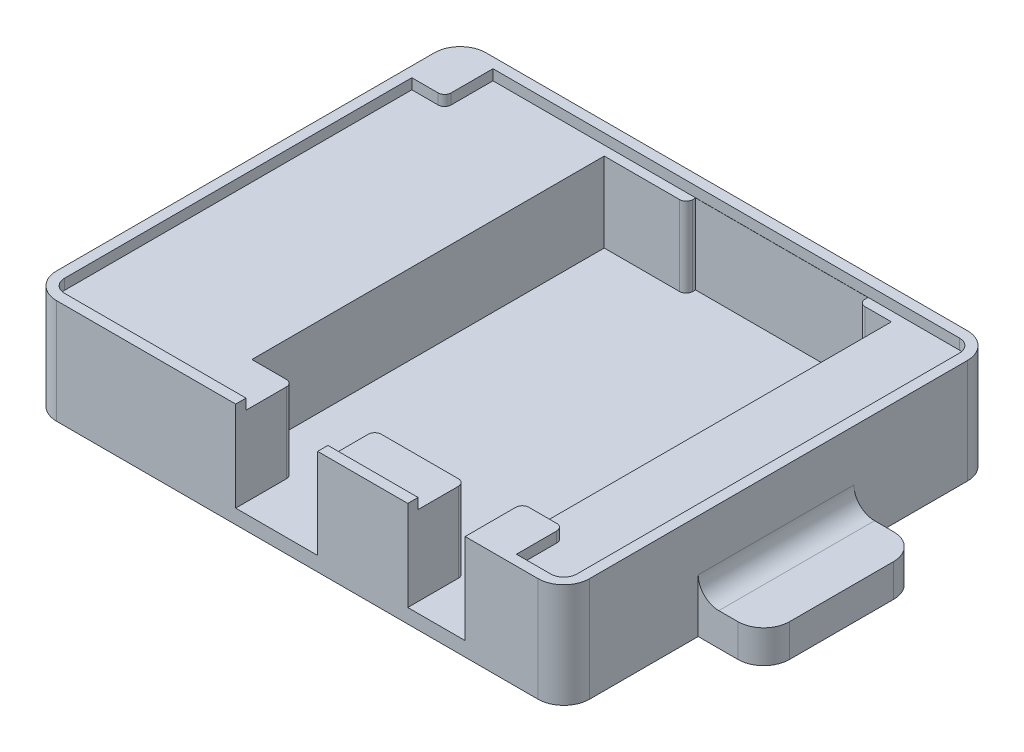
from build123d import *

# Parameters (mm, degrees)
SKETCH1_W           = 103.251
SKETCH1_H           = 83.185
BOSS_EXTRUDE1_DEPTH = 20.2438
CUT_EXTRUDE1_DEPTH  = 17.4625
SKETCH3_W           = 15.875
SKETCH3_H           = 17.4625
SKETCH3_W_2         = 11.1125
CUT_EXTRUDE2_DEPTH  = 14.9225
CUT_EXTRUDE3_DEPTH  = 2.032
SKETCH5_W           = 30.1625
SKETCH5_H           = 6.35
BOSS_EXTRUDE2_DEPTH = 12.7
SKETCH6_W           = 30.1625
SKETCH6_H           = 6.35
BOSS_EXTRUDE3_DEPTH = 12.7
FILLET1_R           = 5
FILLET2_R           = 1.27
FILLET3_R           = 2.54
FILLET4_R           = 4


with BuildPart() as part:
    # Sketch1 → Boss-Extrude1 (new body)
    with BuildSketch(Plane(origin=(0, 0, 0), x_dir=(1, 0, 0), z_dir=(0, 1, 0))):
        with Locations((51.6255, 41.5925)):
            Rectangle(SKETCH1_W, SKETCH1_H)
    extrude(amount=BOSS_EXTRUDE1_DEPTH)

    # Sketch2 → Cut-Extrude1 (cut)
    with BuildSketch(Plane(origin=(0, 20.2438, 0), x_dir=(1, 0, 0), z_dir=(0, 1, 0))):
        Polygon((31.75, 79.3369), (47.625, 79.3369), (47.625, 81.153), (81.026, 81.153), (81.026, 79.3369), (87.376, 79.3369), (87.376, 11.0744), (31.75, 11.0744), align=None)
    extrude(amount=-CUT_EXTRUDE1_DEPTH, mode=Mode.SUBTRACT)

    # Sketch3 → Cut-Extrude2 (cut)
    with BuildSketch(Plane.XY):
        with Locations((47.625, 11.51255)):
            Rectangle(SKETCH3_W, SKETCH3_H)
        with Locations((78.58125, 11.51255)):
            Rectangle(SKETCH3_W_2, SKETCH3_H)
    extrude(amount=-CUT_EXTRUDE2_DEPTH, mode=Mode.SUBTRACT)

    # Sketch4 → Cut-Extrude3 (cut)
    with BuildSketch(Plane(origin=(0, 20.2438, 0), x_dir=(1, 0, 0), z_dir=(0, 1, 0))):
        Polygon((8.35, 81.185), (101.251, 81.185), (101.251, 2), (92.075, 2), (92.075, 11.0744), (84.1375, 11.0744), (84.1375, 2), (2, 2), (2, 71.8124), (8.35, 71.8124), align=None)
    extrude(amount=-CUT_EXTRUDE3_DEPTH, mode=Mode.SUBTRACT)

    # Sketch5 → Boss-Extrude2 (add)
    with BuildSketch(Plane.ZY):
        with Locations((-41.11625, 3.175)):
            Rectangle(SKETCH5_W, SKETCH5_H)
    boss_extrude2 = extrude(amount=BOSS_EXTRUDE2_DEPTH)

    # Mirror1: Boss-Extrude2 across plane
    add(boss_extrude2.mirror(Plane.ZY.offset(-51.6255)))

    # Sketch6 → Boss-Extrude3 (add)
    with BuildSketch(Plane(origin=(0, 0, -83.185), x_dir=(-1, 0, 0), z_dir=(0, 0, -1))):
        with Locations((-51.65725, 3.175)):
            Rectangle(SKETCH6_W, SKETCH6_H)
    extrude(amount=BOSS_EXTRUDE3_DEPTH)

    # Fillet1
    fillet1_edges = [part.edges().sort_by_distance(p)[0] for p in [
        (103.251, 10.1219, 0),
        (115.951, 3.175, -26.035),
        (115.951, 3.175, -56.1975),
        (103.251, 10.1219, -83.185),
        (66.7385, 3.175, -95.885),
        (36.576, 3.175, -95.885),
        (0, 10.1219, -83.185),
        (-12.7, 3.175, -56.1975),
        (-12.7, 3.175, -26.035),
        (0, 10.1219, 0),
    ]]
    fillet(fillet1_edges, radius=FILLET1_R)

    # Fillet2
    fillet2_edges = [part.edges().sort_by_distance(p)[0] for p in [
        (39.6875, 10.49655, -11.0744),
        (55.5625, 10.49655, -11.0744),
        (73.025, 10.49655, -11.0744),
        (92.075, 19.2278, -11.0744),
        (84.1375, 11.51255, -11.0744),
        (81.026, 10.49655, -79.3369),
        (47.625, 10.49655, -79.3369),
        (8.35, 19.2278, -71.8124),
    ]]
    fillet(fillet2_edges, radius=FILLET2_R)

    # Fillet3
    fillet3_edges = [part.edges().sort_by_distance(p)[0] for p in [
        (101.251, 19.2278, -81.185),
        (101.251, 19.2278, -2),
        (2, 19.2278, -2),
    ]]
    fillet(fillet3_edges, radius=FILLET3_R)

    # Fillet4
    fillet4_edges = [part.edges().sort_by_distance(p)[0] for p in [
        (0, 6.35, -41.11625),
        (51.65725, 6.35, -83.185),
        (103.251, 6.35, -41.11625),
    ]]
    fillet(fillet4_edges, radius=FILLET4_R)


solid = part.part
